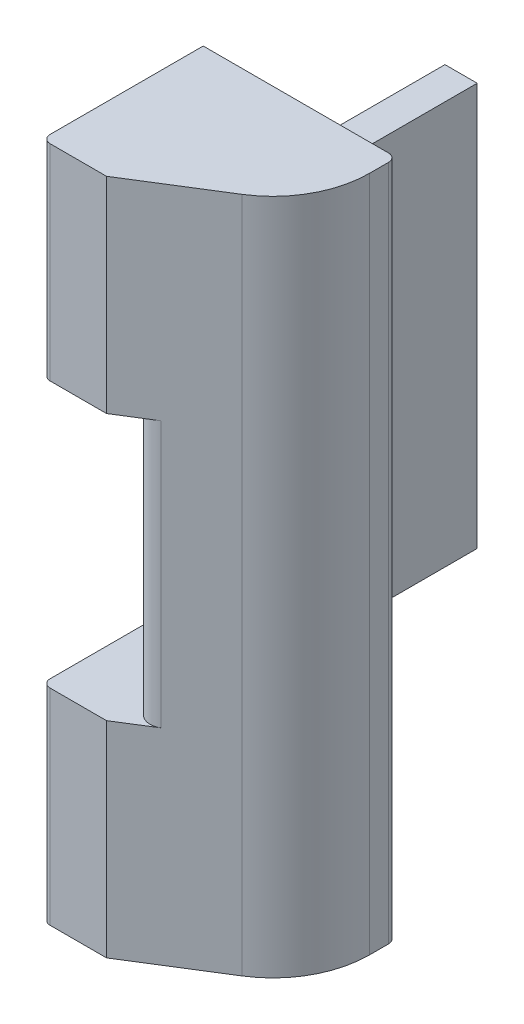
from build123d import *

# Parameters (mm, degrees)
BOSS_EXTRUDE1_DEPTH     = 10
CUT_EXTRUDE1_DEPTH      = 30
CUT_EXTRUDE1_DEPTH_BACK = 30
CUT_EXTRUDE4_DEPTH      = 8.25
CUT_EXTRUDE4_DEPTH_BACK = 8.25
FILLET3_R               = 0.5
BOSS_EXTRUDE2_START     = -6
SKETCH4_W               = 15
SKETCH4_H               = 25
BOSS_EXTRUDE2_DEPTH     = 2
FILLET5_R               = 6
FILLET10_R              = 2
FILLET19_R              = 6
SKETCH9_W               = 1.113670972
SKETCH9_H               = 16.5
CUT_EXTRUDE5_DEPTH      = 10
FILLET21_R              = 1


with BuildPart() as part:
    # Sketch1 → Boss-Extrude1 (new body)
    with BuildSketch(Plane.XY):
        Polygon((-6, -21), (6, -21), (6, 21), (-6, 21), (-6, 8.25), (-2, 8.25), (-2, -8.25), (-6, -8.25), align=None)
    extrude(amount=BOSS_EXTRUDE1_DEPTH)

    # Sketch2 → Cut-Extrude1 (cut, two sides: drawn at the far end of the back side and taken through both)
    with BuildSketch(Plane(origin=(0, 0, 0), x_dir=(1, 0, 0), z_dir=(0, 1, 0)).offset(-CUT_EXTRUDE1_DEPTH_BACK)):
        Polygon((-2, -10), (6, -5), (6, -10), align=None)
    extrude(amount=CUT_EXTRUDE1_DEPTH + CUT_EXTRUDE1_DEPTH_BACK, mode=Mode.SUBTRACT)

    # Sketch8 → Cut-Extrude4 (cut, two sides: drawn at the far end of the back side and taken through both)
    with BuildSketch(Plane(origin=(0, 0, 0), x_dir=(1, 0, 0), z_dir=(0, 1, 0)).offset(-CUT_EXTRUDE4_DEPTH_BACK)):
        Polygon((-2, 0), (-2, -9), (5, -4.466137359), (5, 0), align=None)
    extrude(amount=CUT_EXTRUDE4_DEPTH + CUT_EXTRUDE4_DEPTH_BACK, mode=Mode.SUBTRACT)

    # Fillet3
    fillet3_edges = [part.edges().sort_by_distance(p)[0] for p in [
        (-6, 14.625, 10),
        (6, 0, 0),
        (-6, -14.625, 10),
    ]]
    fillet(fillet3_edges, radius=FILLET3_R)

    # Sketch4 → Boss-Extrude2 (add)
    with BuildSketch(Plane(origin=(0, 0, 0), x_dir=(0, 0, -1), z_dir=(1, 0, 0)).offset(BOSS_EXTRUDE2_START)):
        with Locations((7.5, 0)):
            Rectangle(SKETCH4_W, SKETCH4_H)
    extrude(amount=BOSS_EXTRUDE2_DEPTH)

    # Fillet5
    fillet5_edges = [part.edges().sort_by_distance(p)[0] for p in [
        (-4, -10.375, 0),
        (-4, 10.375, 0),
    ]]
    fillet(fillet5_edges, radius=FILLET5_R)

    # Fillet10
    fillet10_edges = [part.edges().sort_by_distance(p)[0] for p in [
        (-2, 12.5, 0),
        (-2, -12.5, 0),
    ]]
    fillet(fillet10_edges, radius=FILLET10_R)

    # Fillet19
    fillet19_edges = [part.edges().sort_by_distance(p)[0] for p in [
        (6, 0, 5),
    ]]
    fillet(fillet19_edges, radius=FILLET19_R)

    # Sketch9 → Cut-Extrude5 (cut)
    with BuildSketch(Plane.XY):
        with Locations((-2, 0)):
            Rectangle(SKETCH9_W, SKETCH9_H)
    extrude(amount=CUT_EXTRUDE5_DEPTH, mode=Mode.SUBTRACT)

    # Fillet21
    # the kernel refuses this fillet: 1 mm, written as the material it adds along each edge
    with BuildSketch(Plane(origin=(5, -9.609341418, 4.466137359), x_dir=(0, 0, -1), z_dir=(0, 1, 0))) as fillet21_piece_1:
        with BuildLine():
            CenterArc((FILLET21_R * 0.543736567297, FILLET21_R), FILLET21_R, 212.930914829, 57.069085171)
            Line((-FILLET21_R * 0.295590096809, FILLET21_R * 0.456372599182), (0, 0))
            Line((0, 0), (FILLET21_R * 0.543736567297, 0))
        make_face()
    extrude(amount=19.218682836)
    # the kernel refuses this fillet: 1 mm, written as the material it takes off along each edge
    with BuildSketch(Plane(origin=(5, 8.25, 0), x_dir=(1, 0, 0), z_dir=(0, -1, 0))) as fillet21_2_piece_1:
        with BuildLine():
            CenterArc((FILLET21_R, FILLET21_R), FILLET21_R, 180, 90)
            Line((0, FILLET21_R), (0, 0))
            Line((0, 0), (FILLET21_R, 0))
        make_face()
    extrude(amount=16.5, mode=Mode.SUBTRACT)
    with BuildSketch(Plane(origin=(-1.443164514, -8.25, 8.639340628), x_dir=(0, 0, 1), z_dir=(0, 1, 0))) as fillet21_2_piece_2:
        with BuildLine():
            CenterArc((FILLET21_R * 0.543736567297, FILLET21_R), FILLET21_R, 212.930914829, 57.069085171)
            Line((-FILLET21_R * 0.295590096809, FILLET21_R * 0.456372599182), (0, 0))
            Line((0, 0), (FILLET21_R * 0.543736567297, 0))
        make_face()
    extrude(amount=16.5, mode=Mode.SUBTRACT)
    with BuildSketch(Plane(origin=(-1.443164514, -8.25, 9.651977821), x_dir=(0.8479983040050877, 0, -0.5299989400031806), z_dir=(0, 1, 0))) as fillet21_2_piece_3:
        with BuildLine():
            CenterArc((FILLET21_R * 1.80424764151, FILLET21_R), FILLET21_R, 147.994616792, 122.005383208)
            Line((FILLET21_R * 0.956249337502, FILLET21_R * 1.52999894), (0, 0))
            Line((0, 0), (FILLET21_R * 1.80424764151, 0))
        make_face()
    extrude(amount=16.5, mode=Mode.SUBTRACT)


solid = part.part
